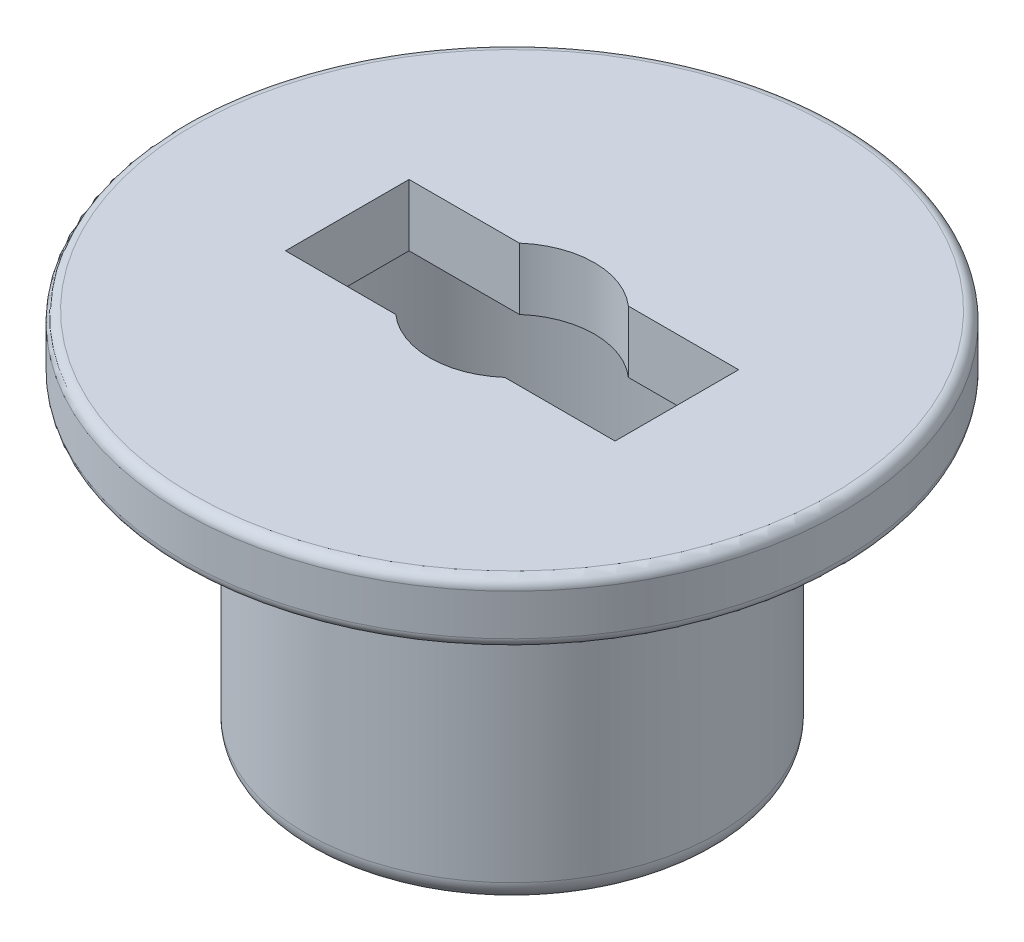
from build123d import *

# Parameters (mm, degrees)
SKETCH1_R           = 16
BOSS_EXTRUDE1_DEPTH = 3
SKETCH3_R           = 1
BOSS_EXTRUDE2_DEPTH = 3
SKETCH4_R           = 10
BOSS_EXTRUDE3_DEPTH = 15
CUT_EXTRUDE1_REACH  = 29.148
SKETCH5_R           = 9
FILLET1_R           = 1
FILLET2_R           = 0.5


with BuildPart() as part:
    # Sketch1 → Boss-Extrude1 (new body)
    with BuildSketch(Plane(origin=(0, 0, 0), x_dir=(1, 0, 0), z_dir=(0, 1, 0))):
        with Locations(Location((0, 0, 0), (0, 0, 270))):
            Circle(SKETCH1_R)
        with BuildLine():
            Line((2.645751311, 3), (8, 3))
            Line((8, 3), (8, -3))
            Line((8, -3), (2.645751311, -3))
            ThreePointArc((2.645751311, -3), (0, -4), (-2.645751311, -3))
            Line((-2.645751311, -3), (-8, -3))
            Line((-8, -3), (-8, 3))
            Line((-8, 3), (-2.645751311, 3))
            ThreePointArc((-2.645751311, 3), (0, 4), (2.645751311, 3))
        make_face(mode=Mode.SUBTRACT)
    extrude(amount=BOSS_EXTRUDE1_DEPTH)

    # Sketch3 → Boss-Extrude2 (add)
    with BuildSketch(Plane.XZ):
        with Locations(Location((-13, 0, 0), (0, 0, 90))):
            Circle(SKETCH3_R)
    extrude(amount=BOSS_EXTRUDE2_DEPTH)

    # Sketch4 → Boss-Extrude3 (add)
    with BuildSketch(Plane.XZ):
        with Locations(Location((0, 0, 0), (0, 0, 90))):
            Circle(SKETCH4_R)
    extrude(amount=BOSS_EXTRUDE3_DEPTH)

    # Sketch5 → Cut-Extrude1 (cut, up to next)
    with BuildSketch(Plane(origin=(0, 0, 0), x_dir=(1, 0, 0), z_dir=(0, 1, 0)), mode=Mode.PRIVATE) as cut_extrude1_sk1:
        with Locations(Location((0, 0, 0), (0, 0, 270))):
            Circle(SKETCH5_R)
    cut_extrude1_tool1 = extrude(cut_extrude1_sk1.sketch, amount=-CUT_EXTRUDE1_REACH, mode=Mode.PRIVATE) & part.part
    add(cut_extrude1_tool1.solids().sort_by_distance((0, 0, 0))[0], mode=Mode.SUBTRACT)

    # Fillet1
    fillet1_edges = [part.edges().sort_by_distance(p)[0] for p in [
        (0, -15, -10),
    ]]
    fillet(fillet1_edges, radius=FILLET1_R - 0.0001)  # a hair under: the kernel refuses the full size

    # Fillet2
    fillet2_edges = [part.edges().sort_by_distance(p)[0] for p in [
        (0, 0, -16),
        (0, 3, -16),
    ]]
    fillet(fillet2_edges, radius=FILLET2_R)


solid = part.part
